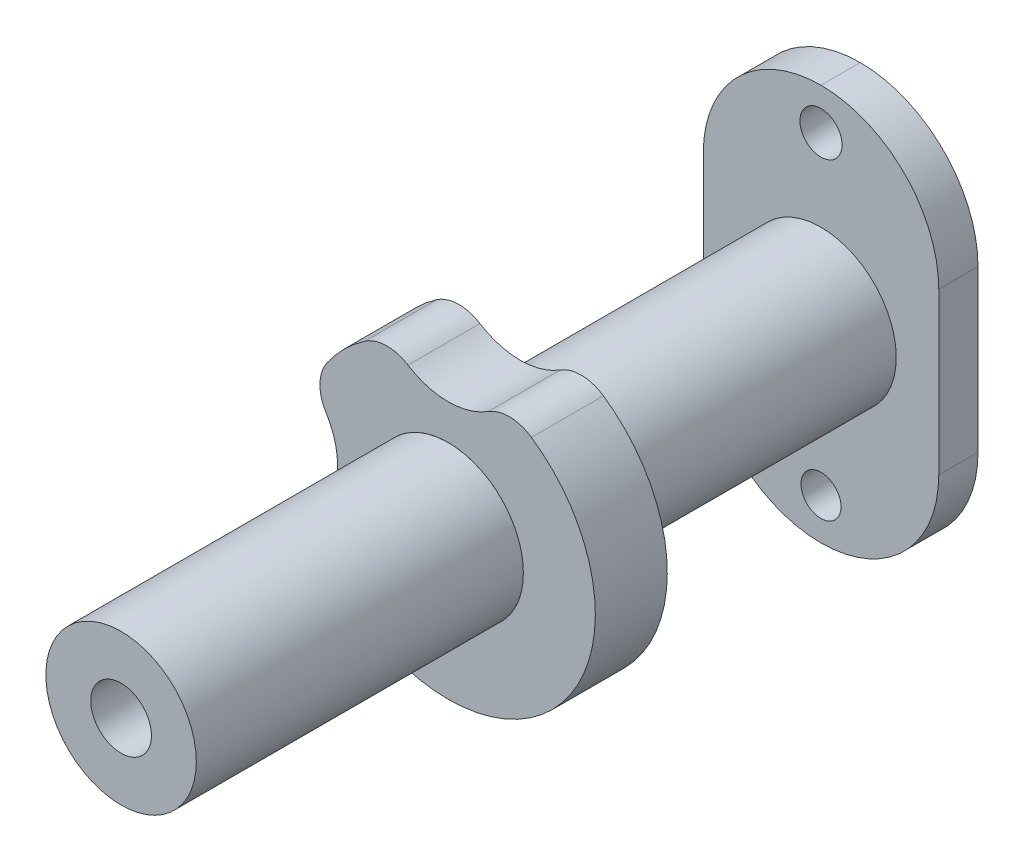
from build123d import *
from build123d.topology import SkipClean

# Parameters (mm, degrees)
CROQUIS4_R               = 5.75
SALIENTE_EXTRUIR3_DEPTH  = 15.5
CROQUIS5_R               = 11.25
SALIENTE_EXTRUIR4_DEPTH  = 5.5
CROQUIS7_R               = 2.32
CORTAR_EXTRUIR2_DEPTH    = 25.5
SALIENTE_EXTRUIR5_START  = 12.7
CROQUIS8_R               = 5.75
SALIENTE_EXTRUIR5_DEPTH  = 12.7
CROQUIS9_W               = 18
CROQUIS9_H               = 30.3
SALIENTE_EXTRUIR6_DEPTH  = 3
CORTAR_EXTRUIR3_START    = -53
CROQUIS10_R              = 2.32
CORTAR_EXTRUIR3_DEPTH    = 53
REDONDEO5_R              = 9
CROQUIS14_R              = 1.610440683
CROQUIS14_R_2            = 1.53
CORTAR_EXTRUIR4_DEPTH    = 10
CROQUIS15_R              = 5.75
CROQUIS15_R_2            = 2.32
SALIENTE_EXTRUIR8_DEPTH  = 3
CROQUIS22_R              = 11.25
SALIENTE_EXTRUIR10_DEPTH = 10
CROQUIS24_R              = 23.765334052
CROQUIS24_R_2            = 5.75
CORTAR_EXTRUIR7_DEPTH    = 22.5
CROQUIS25_R              = 11.25
SALIENTE_EXTRUIR11_DEPTH = 5.5
CROQUIS27_R              = 11.25
CROQUIS27_R_2            = 5.75
CORTAR_EXTRUIR10_DEPTH   = 0.5
CROQUIS29_R              = 11.25
CROQUIS29_R_2            = 5.75
SALIENTE_EXTRUIR12_DEPTH = 5.5
CROQUIS30_R              = 5.75
SALIENTE_EXTRUIR13_DEPTH = 25
CROQUIS31_R              = 2.32
CORTAR_EXTRUIR11_DEPTH   = 105
CROQUIS32_R              = 5.75
CORTAR_EXTRUIR12_DEPTH   = 10
REDONDEO6_R              = 3


with BuildPart() as part:
    # Croquis4 → Saliente-Extruir3 (new body)
    with BuildSketch(Plane.XY):
        Circle(CROQUIS4_R)
    extrude(amount=SALIENTE_EXTRUIR3_DEPTH)

    # Croquis5 → Saliente-Extruir4 (add)
    with BuildSketch(Plane(origin=(0, 0, 0), x_dir=(-1, 0, 0), z_dir=(0, 0, -1))):
        Circle(CROQUIS5_R)
    extrude(amount=-SALIENTE_EXTRUIR4_DEPTH)

    # Croquis7 → Cortar-Extruir2 (cut)
    with BuildSketch(Plane(origin=(0, 0, 0), x_dir=(-1, 0, 0), z_dir=(0, 0, -1))):
        Circle(CROQUIS7_R)
    extrude(amount=-CORTAR_EXTRUIR2_DEPTH, mode=Mode.SUBTRACT)

    # Croquis8 → Saliente-Extruir5 (add)
    with BuildSketch(Plane(origin=(0, 0, 0), x_dir=(-1, 0, 0), z_dir=(0, 0, -1)).offset(SALIENTE_EXTRUIR5_START)):
        Circle(CROQUIS8_R)
    extrude(amount=-SALIENTE_EXTRUIR5_DEPTH)

    # Croquis9 → Saliente-Extruir6 (add)
    with BuildSketch(Plane(origin=(0, 0, -12.7), x_dir=(-1, 0, 0), z_dir=(0, 0, -1))):
        Rectangle(CROQUIS9_W, CROQUIS9_H)
    extrude(amount=-SALIENTE_EXTRUIR6_DEPTH)

    # Croquis10 → Cortar-Extruir3 (cut)
    with BuildSketch(Plane.XY.offset(15.5).offset(CORTAR_EXTRUIR3_START)):
        with Locations(Location((0, 0, 0), (0, 0, 180))):
            Circle(CROQUIS10_R)
    extrude(amount=CORTAR_EXTRUIR3_DEPTH, mode=Mode.SUBTRACT)

    # Redondeo5
    redondeo5_edges = [part.edges().sort_by_distance(p)[0] for p in [
        (9, -15.15, -11.2),
        (-9, -15.15, -11.2),
        (-9, 15.15, -11.2),
        (9, 15.15, -11.2),
    ]]
    fillet(redondeo5_edges, radius=REDONDEO5_R - 0.0001)  # a hair under: the kernel refuses the full size

    # Croquis14 → Cortar-Extruir4 (cut)
    with BuildSketch(Plane(origin=(0, 0, -12.7), x_dir=(-1, 0, 0), z_dir=(0, 0, -1))):
        with Locations((0, 12)):
            Circle(CROQUIS14_R)
        with Locations((0, -12)):
            Circle(CROQUIS14_R_2)
    extrude(amount=-CORTAR_EXTRUIR4_DEPTH, mode=Mode.SUBTRACT)

    # Croquis15 → Saliente-Extruir8 (add)
    with SkipClean():  # the faces are left unmerged after this step: merging them gives an invalid solid
        with BuildSketch(Plane.XY.offset(15.5)):
            with Locations(Location((0, 0, 0), (0, 0, 180))):
                Circle(CROQUIS15_R)
            with Locations(Location((0, 0, 0), (0, 0, 180))):
                Circle(CROQUIS15_R_2, mode=Mode.SUBTRACT)
        extrude(amount=SALIENTE_EXTRUIR8_DEPTH)

    # Croquis22 → Saliente-Extruir10 (add)
    with BuildSketch(Plane.XY.offset(5.5)):
        with Locations(Location((0, 0, 0), (0, 0, 180))):
            Circle(CROQUIS22_R)
    extrude(amount=SALIENTE_EXTRUIR10_DEPTH)

    # Croquis24 → Cortar-Extruir7 (cut)
    with BuildSketch(Plane.XY.offset(-9.7)):
        Circle(CROQUIS24_R)
        Circle(CROQUIS24_R_2, mode=Mode.SUBTRACT)
    extrude(amount=CORTAR_EXTRUIR7_DEPTH, mode=Mode.SUBTRACT)

    # Croquis25 → Saliente-Extruir11 (add)
    with SkipClean():  # the faces are left unmerged after this step: merging them gives an invalid solid
        with BuildSketch(Plane(origin=(0, 0, 12.8), x_dir=(-1, 0, 0), z_dir=(0, 0, -1))):
            Circle(CROQUIS25_R)
        extrude(amount=-SALIENTE_EXTRUIR11_DEPTH)

    # Croquis27 → Cortar-Extruir10 (cut)
    with SkipClean():  # the faces are left unmerged after this step: merging them gives an invalid solid
        with BuildSketch(Plane(origin=(0, 0, 12.8), x_dir=(-1, 0, 0), z_dir=(0, 0, -1))):
            Circle(CROQUIS27_R)
            Circle(CROQUIS27_R_2, mode=Mode.SUBTRACT)
        extrude(amount=-CORTAR_EXTRUIR10_DEPTH, mode=Mode.SUBTRACT)

    # Croquis29 → Saliente-Extruir12 (add)
    with SkipClean():  # the faces are left unmerged after this step: merging them gives an invalid solid
        with BuildSketch(Plane(origin=(0, 0, 13.3), x_dir=(-1, 0, 0), z_dir=(0, 0, -1))):
            Circle(CROQUIS29_R)
            with Locations(Location((0, 0, 0), (0, 0, 180))):
                Circle(CROQUIS29_R_2, mode=Mode.SUBTRACT)
        extrude(amount=-SALIENTE_EXTRUIR12_DEPTH)


with BuildPart() as body_2:
    # Croquis30 → Saliente-Extruir13 (new body)
    with BuildSketch(Plane.XY.offset(18.8)):
        Circle(CROQUIS30_R)
    extrude(amount=SALIENTE_EXTRUIR13_DEPTH)


with BuildPart() as cortar_extruir11_tool:
    # Croquis31 → Cortar-Extruir11 (new body)
    with BuildSketch(Plane(origin=(0, 0, -12.7), x_dir=(-1, 0, 0), z_dir=(0, 0, -1))):
        with Locations(Location((0, 0, 0), (0, 0, 180))):
            Circle(CROQUIS31_R)
    extrude(amount=-CORTAR_EXTRUIR11_DEPTH)


with BuildPart() as part_1:
    add(part.part)

    # Cortar-Extruir11: cut by cortar_extruir11_tool
    add(cortar_extruir11_tool.part, mode=Mode.SUBTRACT)

    # Croquis32 → Cortar-Extruir12 (cut)
    with BuildSketch(Plane.XY.offset(18.8)):
        with Locations((-14.2, 0)):
            Circle(CROQUIS32_R)
        with Locations((0, 14.2)):
            Circle(CROQUIS32_R)
    extrude(amount=-CORTAR_EXTRUIR12_DEPTH, mode=Mode.SUBTRACT)

    # Redondeo6
    redondeo6_edges = [part_1.edges().sort_by_distance(p)[0] for p in [
        (-10.392253521, 4.308545782, 16.9),
        (-10.392253521, -4.308545782, 16.9),
        (4.308545782, 10.392253521, 16.9),
        (-4.308545782, 10.392253521, 16.9),
    ]]
    fillet(redondeo6_edges, radius=REDONDEO6_R)


with BuildPart() as body_2_1:
    add(body_2.part)

    # Cortar-Extruir11: cut by cortar_extruir11_tool
    add(cortar_extruir11_tool.part, mode=Mode.SUBTRACT)


solid = Compound([part_1.part, body_2_1.part])
